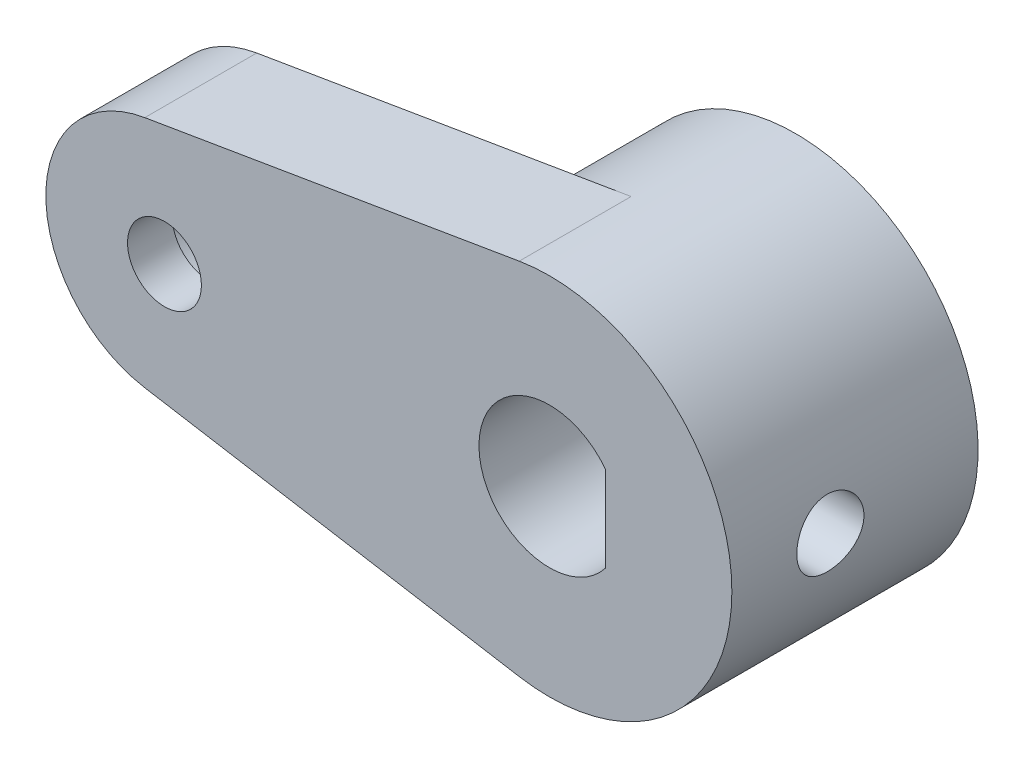
from build123d import *
from build123d.topology import SkipClean

# Parameters (mm, degrees)
SKETCH1_R               = 22.5
SKETCH1_R_2             = 3.15
SKETCH1_R_3             = 1.65
BOSS_EXTRUDE1_DEPTH     = 2
BOSS_EXTRUDE2_START     = 9
SKETCH2_R               = 8.15
SKETCH2_R_2             = 3.15
BOSS_EXTRUDE2_DEPTH     = 9
CUT_EXTRUDE1_DEPTH      = 53.886222213
CUT_EXTRUDE1_DEPTH_BACK = 53.886222213
SKETCH3_W               = 59.321790447
SKETCH3_H               = 68.701430229
BOSS_EXTRUDE4_START     = -11
BOSS_EXTRUDE4_DEPTH     = 11
CUT_EXTRUDE2_DEPTH      = 2.8
CUT_EXTRUDE2_DEPTH_BACK = 2
CUT_EXTRUDE2_START      = -9.55
SKETCH5_R               = 1.5
CUT_EXTRUDE3_DEPTH      = 35.543052847
BOSS_EXTRUDE3_START     = 3
SKETCH6_R               = 2.9
BOSS_EXTRUDE3_DEPTH     = 3


# Read off the part's stored shape, not the designer's step: Boss-Extrude4
with BuildPart() as part:
    # Sketch1 → Boss-Extrude1 (new body)
    with BuildSketch(Plane.XY):
        with Locations((-12.05, 16)):
            Circle(SKETCH1_R)
        with Locations((-12.05, 16)):
            Circle(SKETCH1_R_2, mode=Mode.SUBTRACT)
        with Locations((-29.25, 16)):
            Circle(SKETCH1_R_3, mode=Mode.SUBTRACT)
        with Locations((5.15, 16)):
            Circle(SKETCH1_R_3, mode=Mode.SUBTRACT)
    extrude(amount=BOSS_EXTRUDE1_DEPTH)

    # Sketch2 → Boss-Extrude2 (add)
    with SkipClean():  # the faces are left unmerged after this step: merging them gives an invalid solid
        with BuildSketch(Plane(origin=(0, 0, 0), x_dir=(-1, 0, 0), z_dir=(0, 0, -1)).offset(BOSS_EXTRUDE2_START)):
            with Locations(Location((12.05, 16, 0), (0, 0, 180))):
                Circle(SKETCH2_R)
            with Locations((12.05, 16)):
                Circle(SKETCH2_R_2, mode=Mode.SUBTRACT)
        extrude(amount=-BOSS_EXTRUDE2_DEPTH)

    # Sketch3 → Cut-Extrude1 (cut, two sides: drawn at the far end of the back side and taken through both)
    with BuildSketch(Plane.XY.offset(2).offset(-CUT_EXTRUDE1_DEPTH_BACK)):
        with Locations((-10.056838751, 16.22852839)):
            Rectangle(SKETCH3_W, SKETCH3_H)
        with BuildLine():
            Line((-30.128197674, 10.773264035), (-13.400436047, 7.962660734))
            ThreePointArc((-13.400436047, 7.962660734), (-3.9, 16), (-13.400436047, 24.037339266))
            Line((-13.400436047, 24.037339266), (-30.128197674, 21.226735965))
            ThreePointArc((-30.128197674, 21.226735965), (-34.55, 16), (-30.128197674, 10.773264035))
        make_face(mode=Mode.SUBTRACT)
    extrude(amount=CUT_EXTRUDE1_DEPTH + CUT_EXTRUDE1_DEPTH_BACK, mode=Mode.SUBTRACT)

    # Boss-Extrude4 outline → Boss-Extrude4 (add)
    with BuildSketch(Plane.XY.offset(2).offset(BOSS_EXTRUDE4_START)):
        with BuildLine():
            ThreePointArc((-9.55, 14.08362321), (-8.9, 16), (-9.55, 17.91637679))
            Line((-9.55, 17.91637679), (-9.55, 14.08362321))
        make_face()
    extrude(amount=BOSS_EXTRUDE4_DEPTH)

    # Sketch4 → Cut-Extrude2 (cut, two sides: drawn at the far end of the back side and taken through both)
    with BuildSketch(Plane(origin=(0, 0, 0), x_dir=(0, 0, -1), z_dir=(1, 0, 0)).offset(CUT_EXTRUDE2_START - CUT_EXTRUDE2_DEPTH_BACK)):
        Polygon((-0.5, 17.675), (-0.5, 14.325), (2.401185103, 12.65), (5.302370205, 14.325), (5.302370205, 17.675), (2.401185103, 19.35), align=None)
    extrude(amount=CUT_EXTRUDE2_DEPTH + CUT_EXTRUDE2_DEPTH_BACK, mode=Mode.SUBTRACT)

    # Sketch5 → Cut-Extrude3 (cut, through all)
    with BuildSketch(Plane.ZY.offset(11.55)):
        with Locations((-2.401185103, 16)):
            Circle(SKETCH5_R)
    extrude(amount=-CUT_EXTRUDE3_DEPTH, mode=Mode.SUBTRACT)

    # Sketch6 → Boss-Extrude3 (add)
    with BuildSketch(Plane(origin=(0, 0, 0), x_dir=(-1, 0, 0), z_dir=(0, 0, -1)).offset(BOSS_EXTRUDE3_START)):
        with BuildLine():
            Line((30.128197674, 21.226735965), (13.400436047, 24.037339266))
            ThreePointArc((13.400436047, 24.037339266), (20.2, 16), (13.400436047, 7.962660734))
            Line((13.400436047, 7.962660734), (30.128197674, 10.773264035))
            ThreePointArc((30.128197674, 10.773264035), (34.55, 16), (30.128197674, 21.226735965))
        make_face()
        with Locations((29.25, 16)):
            Circle(SKETCH6_R, mode=Mode.SUBTRACT)
    extrude(amount=-BOSS_EXTRUDE3_DEPTH)


solid = part.part
